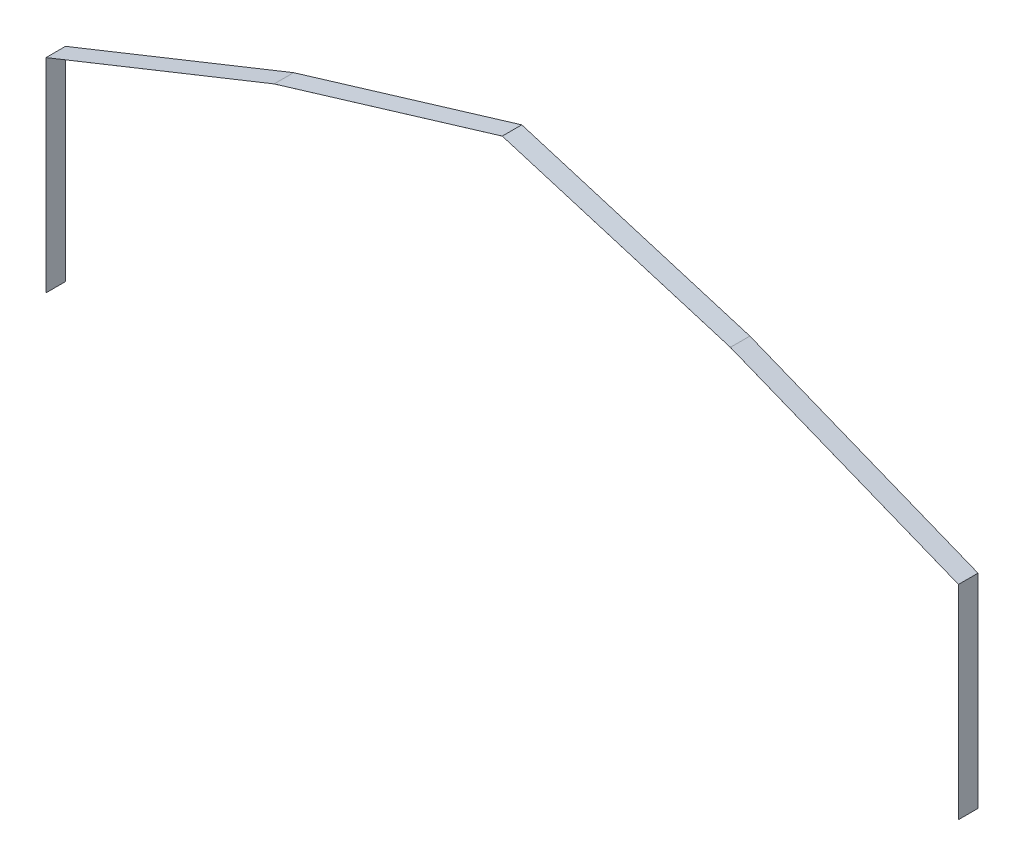
from build123d import *

# Parameters (mm, degrees)
EXTRUIR_L_MINA1_DEPTH = 254


with BuildPart() as part:
    # Croquis1 → Extruir-Lámina1 (new, symmetric)
    with BuildSketch(Plane.XY):
        Polygon((0, -5308.6), (0, 0), (5943.6, 2377.44), (11887.2, 4172.078181077), (17830.8, 2377.44), (23774.4, 0), (23774.4, -5308.6), (23774.654, -5308.6), (23774.654, 0.171966372), (17830.884036537, 2377.679951757), (11887.2, 4172.343507217), (5943.515963463, 2377.679951757), (-0.254, 0.171966372), (-0.254, -5308.6), align=None)
    extrude(amount=EXTRUIR_L_MINA1_DEPTH, both=True)


solid = part.part
